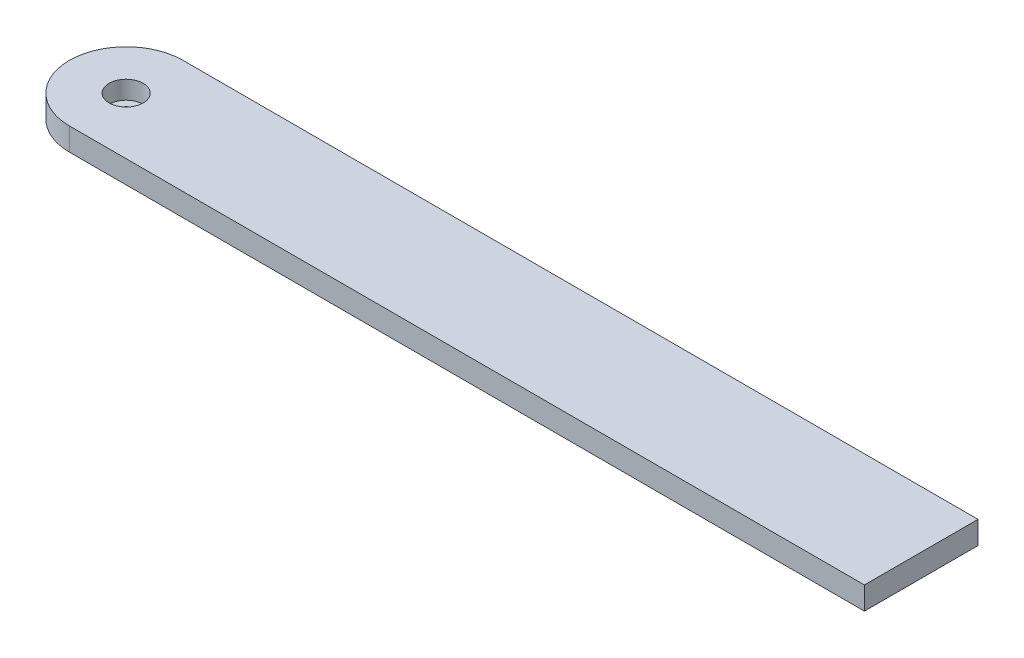
from build123d import *

# Parameters (mm, degrees)
BOSS_EXTRUDE1_DEPTH = 2
SKETCH2_R           = 1.5
CUT_EXTRUDE1_DEPTH  = 1.6
SKETCH3_R           = 0.8
CUT_EXTRUDE2_DEPTH  = 3


with BuildPart() as part:
    # Sketch1 → Boss-Extrude1 (new body)
    with BuildSketch(Plane(origin=(0, 0, 0), x_dir=(1, 0, 0), z_dir=(0, 1, 0))):
        with BuildLine():
            Line((70, 5), (0, 5))
            ThreePointArc((0, 5), (-5, 0), (0, -5))
            Line((0, -5), (70, -5))
            Line((70, -5), (70, 5))
        make_face()
    extrude(amount=BOSS_EXTRUDE1_DEPTH)

    # Sketch2 → Cut-Extrude1 (cut)
    with BuildSketch(Plane(origin=(0, 2, 0), x_dir=(1, 0, 0), z_dir=(0, 1, 0))):
        Circle(SKETCH2_R)
    extrude(amount=-CUT_EXTRUDE1_DEPTH, mode=Mode.SUBTRACT)

    # Sketch3 → Cut-Extrude2 (cut)
    with BuildSketch(Plane(origin=(0, 0.4, 0), x_dir=(1, 0, 0), z_dir=(0, 1, 0))):
        Circle(SKETCH3_R)
    extrude(amount=-CUT_EXTRUDE2_DEPTH, mode=Mode.SUBTRACT)


solid = part.part
